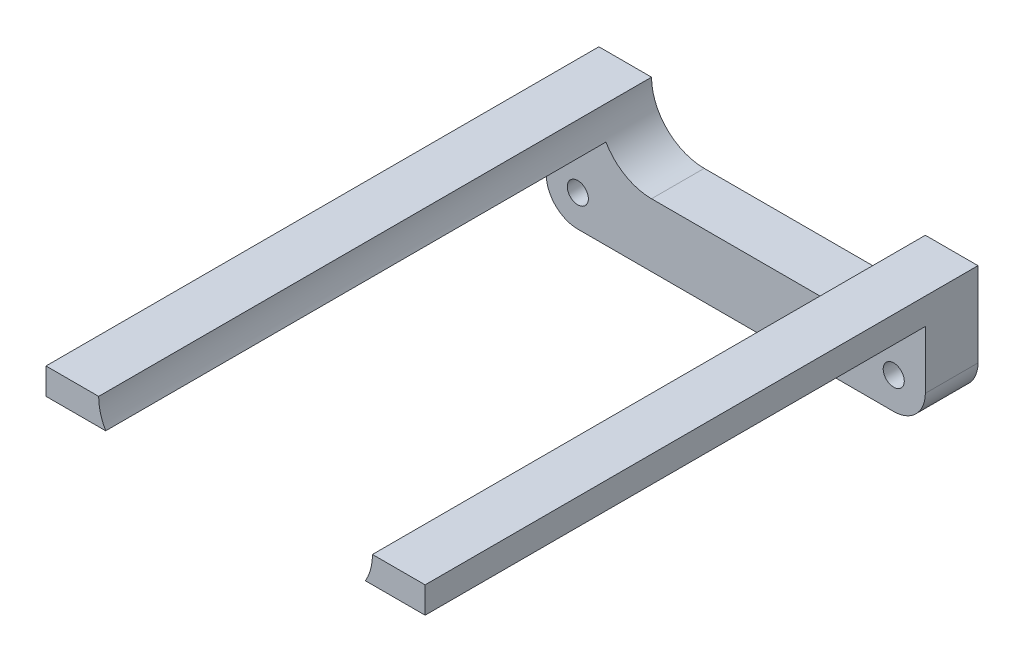
from build123d import *

# Parameters (mm, degrees)
SKETCH1_R           = 2
BOSS_EXTRUDE1_DEPTH = 5
SKETCH1_3_W         = 10
SKETCH1_3_H         = 5
BOSS_EXTRUDE2_DEPTH = 100
FILLET1_R           = 10


with BuildPart() as part:
    # Sketch1 → Boss-Extrude1 (new, symmetric)
    with BuildSketch(Plane.XY):
        with BuildLine():
            ThreePointArc((-36, 0), (-34.242640687, -4.242640687), (-30, -6))
            Line((-30, -6), (30, -6))
            ThreePointArc((30, -6), (34.242640687, -4.242640687), (36, 0))
            Line((36, 0), (36, 16))
            Line((36, 16), (26, 16))
            Line((26, 16), (26, 6))
            Line((26, 6), (-26, 6))
            Line((-26, 6), (-26, 16))
            Line((-26, 16), (-36, 16))
            Line((-36, 16), (-36, 0))
        make_face()
        with Locations((-30, 0)):
            Circle(SKETCH1_R, mode=Mode.SUBTRACT)
        with Locations((30, 0)):
            Circle(SKETCH1_R, mode=Mode.SUBTRACT)
    extrude(amount=BOSS_EXTRUDE1_DEPTH, both=True)

    # Sketch1<3> → Boss-Extrude2 (add)
    with BuildSketch(Plane.XY):
        with Locations((-31, 13.5)):
            Rectangle(SKETCH1_3_W, SKETCH1_3_H)
        with Locations((31, 13.5)):
            Rectangle(SKETCH1_3_W, SKETCH1_3_H)
    extrude(amount=BOSS_EXTRUDE2_DEPTH)

    # Fillet1
    fillet1_edges = [part.edges().sort_by_distance(p)[0] for p in [
        (26, 6, 0),
        (-26, 6, 0),
    ]]
    fillet(fillet1_edges, radius=FILLET1_R - 0.0001)  # a hair under: the kernel refuses the full size


solid = part.part
